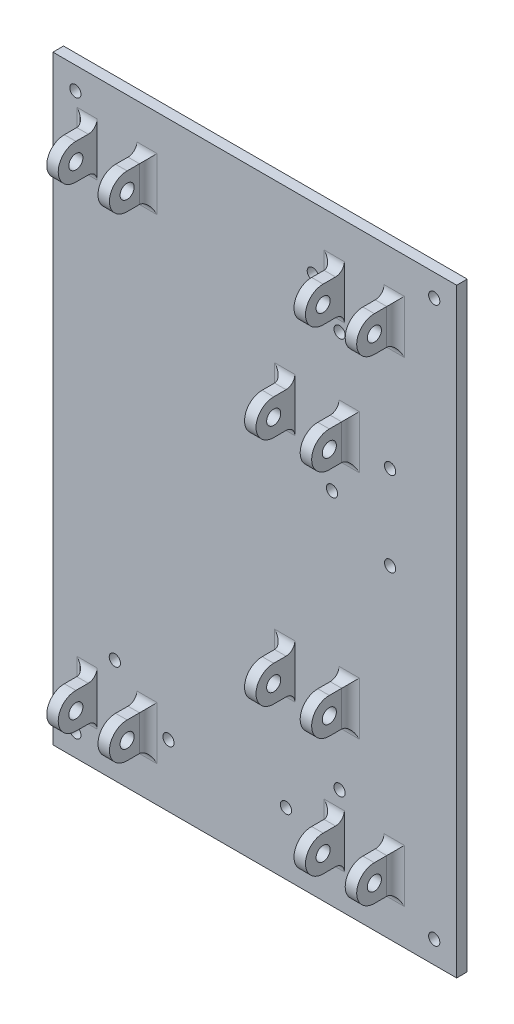
from build123d import *

# Parameters (mm, degrees)
SKETCH1_W               = 228.6
SKETCH1_H               = 339.725
BOSS_EXTRUDE1_DEPTH     = 6
SKETCH2_W               = 6.5
SKETCH2_H               = 20
BOSS_EXTRUDE2_DEPTH     = 24
CUT_EXTRUDE1_DEPTH      = 401.568453108
CUT_EXTRUDE1_DEPTH_BACK = 401.568453108
SKETCH3_R               = 4
FILLET2_R               = 5
SKETCH5_R               = 3.175
CUT_EXTRUDE2_DEPTH      = 411.067111123


with BuildPart() as part:
    # Sketch1 → Boss-Extrude1 (new body)
    with BuildSketch(Plane.XY):
        with Locations((114.3, -169.8625)):
            Rectangle(SKETCH1_W, SKETCH1_H)
    extrude(amount=BOSS_EXTRUDE1_DEPTH)

    # Sketch2 → Boss-Extrude2 (add)
    with BuildSketch(Plane.XY.offset(6)):
        with Locations((21.75, -35.2425)):
            Rectangle(SKETCH2_W, SKETCH2_H)
        with Locations((50.75, -35.2425)):
            Rectangle(SKETCH2_W, SKETCH2_H)
        with Locations((161.75, -35.2425)):
            Rectangle(SKETCH2_W, SKETCH2_H)
        with Locations((190.75, -35.2425)):
            Rectangle(SKETCH2_W, SKETCH2_H)
        with Locations((133.75, -104.5325)):
            Rectangle(SKETCH2_W, SKETCH2_H)
        with Locations((165.25, -104.5325)):
            Rectangle(SKETCH2_W, SKETCH2_H)
        with Locations((165.25, -235.1925)):
            Rectangle(SKETCH2_W, SKETCH2_H)
        with Locations((21.75, -304.4825)):
            Rectangle(SKETCH2_W, SKETCH2_H)
        with Locations((50.75, -304.4825)):
            Rectangle(SKETCH2_W, SKETCH2_H)
        with Locations((190.75, -304.4825)):
            Rectangle(SKETCH2_W, SKETCH2_H)
        with Locations((161.75, -304.4825)):
            Rectangle(SKETCH2_W, SKETCH2_H)
        with Locations((133.75, -235.1925)):
            Rectangle(SKETCH2_W, SKETCH2_H)
    extrude(amount=BOSS_EXTRUDE2_DEPTH)

    # Sketch3 → Cut-Extrude1 (cut, two sides: drawn at the far end of the back side and taken through both)
    with BuildSketch(Plane.ZY.offset(-18.5).offset(-CUT_EXTRUDE1_DEPTH_BACK)):
        with Locations((18, -35.2425)):
            Circle(SKETCH3_R)
        with Locations((18, -235.1925)):
            Circle(SKETCH3_R)
        with Locations((18, -304.4825)):
            Circle(SKETCH3_R)
        with Locations((18, -104.5325)):
            Circle(SKETCH3_R)
        with BuildLine():
            Line((18, -25.2425), (18, -12.982943413))
            Line((18, -12.982943413), (51.949532367, -12.982943413))
            Line((51.949532367, -12.982943413), (51.949532367, -57.481006387))
            Line((51.949532367, -57.481006387), (18, -57.481006387))
            Line((18, -57.481006387), (18, -45.2425))
            ThreePointArc((18, -45.2425), (28, -35.2425), (18, -25.2425))
        make_face()
        with BuildLine():
            Line((52.442304634, -132.399123951), (18, -132.399123951))
            Line((18, -132.399123951), (18, -114.5325))
            ThreePointArc((18, -114.5325), (28, -104.5325), (18, -94.5325))
            Line((18, -94.5325), (18, -71.59149594))
            Line((18, -71.59149594), (52.442304634, -71.59149594))
            Line((52.442304634, -71.59149594), (52.442304634, -132.399123951))
        make_face()
        with BuildLine():
            Line((52.599532243, -270.375386727), (18, -270.375386727))
            Line((18, -270.375386727), (18, -245.1925))
            ThreePointArc((18, -245.1925), (28, -235.1925), (18, -225.1925))
            Line((18, -225.1925), (18, -207.306351849))
            Line((18, -207.306351849), (52.599532243, -207.306351849))
            Line((52.599532243, -207.306351849), (52.599532243, -270.375386727))
        make_face()
        with BuildLine():
            Line((52.621034016, -326.721115515), (18, -326.721115515))
            Line((18, -326.721115515), (18, -314.4825))
            ThreePointArc((18, -314.4825), (28, -304.4825), (18, -294.4825))
            Line((18, -294.4825), (18, -282.222834285))
            Line((18, -282.222834285), (52.621034016, -282.222834285))
            Line((52.621034016, -282.222834285), (52.621034016, -326.721115515))
        make_face()
    extrude(amount=CUT_EXTRUDE1_DEPTH + CUT_EXTRUDE1_DEPTH_BACK, mode=Mode.SUBTRACT)

    # Fillet2
    fillet2_edges = [part.edges().sort_by_distance(p)[0] for p in [
        (158.5, -304.4825, 6),
        (18.5, -304.4825, 6),
        (21.75, -45.2425, 6),
        (18.5, -35.2425, 6),
        (21.75, -25.2425, 6),
        (50.75, -25.2425, 6),
        (50.75, -45.2425, 6),
        (54, -35.2425, 6),
        (161.75, -25.2425, 6),
        (190.75, -25.2425, 6),
        (194, -35.2425, 6),
        (190.75, -45.2425, 6),
        (161.75, -45.2425, 6),
        (158.5, -35.2425, 6),
        (168.5, -104.5325, 6),
        (165.25, -114.5325, 6),
        (133.75, -114.5325, 6),
        (130.5, -104.5325, 6),
        (165.25, -94.5325, 6),
        (133.75, -94.5325, 6),
        (21.75, -294.4825, 6),
        (50.75, -294.4825, 6),
        (54, -304.4825, 6),
        (194, -304.4825, 6),
        (161.75, -294.4825, 6),
        (190.75, -294.4825, 6),
        (190.75, -314.4825, 6),
        (161.75, -314.4825, 6),
        (50.75, -314.4825, 6),
        (21.75, -314.4825, 6),
        (165.25, -225.1925, 6),
        (133.75, -225.1925, 6),
        (130.5, -235.1925, 6),
        (133.75, -245.1925, 6),
        (165.25, -245.1925, 6),
        (168.5, -235.1925, 6),
    ]]
    fillet(fillet2_edges, radius=FILLET2_R)

    # Sketch5 → Cut-Extrude2 (cut, through all)
    with BuildSketch(Plane.XY.offset(6)):
        with Locations((12.7, -12.7)):
            Circle(SKETCH5_R)
        with Locations((215.9, -12.7)):
            Circle(SKETCH5_R)
        with Locations((147.15, -35.2425)):
            Circle(SKETCH5_R)
        with Locations((162.306, -56.1175)):
            Circle(SKETCH5_R)
        with Locations((34.925, -56.5925)):
            Circle(SKETCH5_R)
        with Locations((190.92, -108.713)):
            Circle(SKETCH5_R)
        with Locations((158.028, -136.132936151)):
            Circle(SKETCH5_R)
        with Locations((190.92, -156.463)):
            Circle(SKETCH5_R)
        with Locations((35.052, -280.6075)):
            Circle(SKETCH5_R)
        with Locations((65.404, -304.4825)):
            Circle(SKETCH5_R)
        with Locations((12.7, -327.025)):
            Circle(SKETCH5_R)
        with Locations((215.9, -327.025)):
            Circle(SKETCH5_R)
        with Locations((131.954, -304.4825)):
            Circle(SKETCH5_R)
        with Locations((162.306, -280.6075)):
            Circle(SKETCH5_R)
    extrude(amount=-CUT_EXTRUDE2_DEPTH, mode=Mode.SUBTRACT)


solid = part.part
